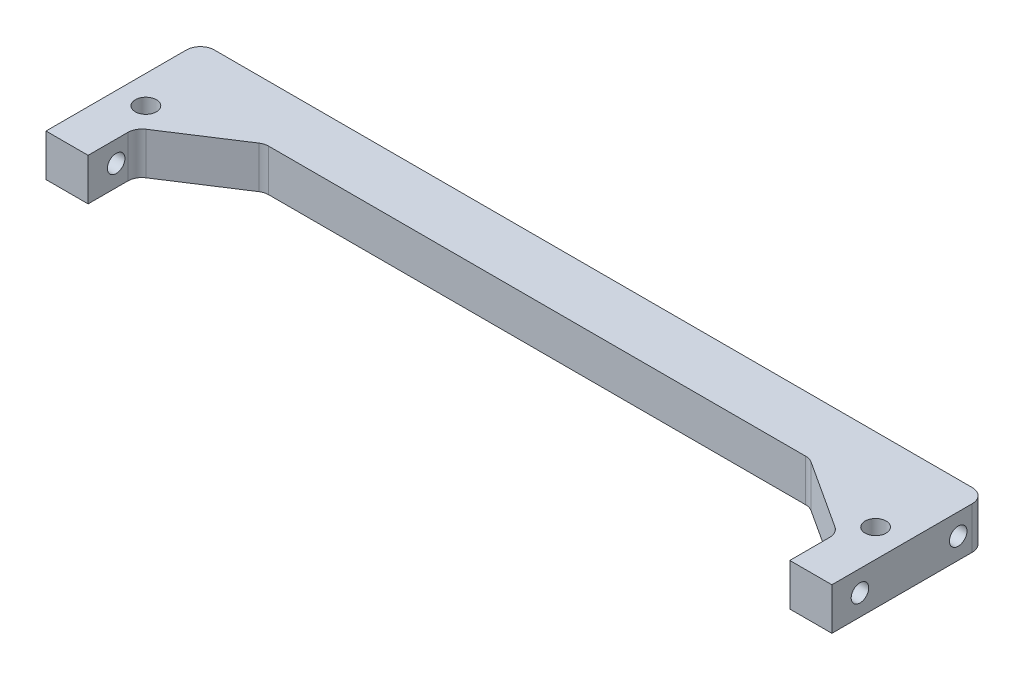
from build123d import *

# Parameters (mm, degrees)
SKETCH1_R                        = 1.5
BOSS_EXTRUDE1_DEPTH              = 6
FILLET1_R                        = 2
TAP_DRILL_FOR_M3_TAP1_AT_2_COUNT = 2
TAP_DRILL_FOR_M3_TAP1_AT_2_PITCH = 14
FILLET1_OF_MIRROR1_R             = 2


with BuildPart() as part:
    # Sketch1 → Boss-Extrude1 (new body)
    with BuildSketch(Plane(origin=(0, 0, 0), x_dir=(1, 0, 0), z_dir=(0, 1, 0))):
        Polygon((0, -22), (-56, -22), (-56, -44), (-50, -44), (-50, -37.239832831), (-38.851635079, -30), (0, -30), align=None)
        with Locations((-51.997575213, -33.767620171)):
            Circle(SKETCH1_R, mode=Mode.SUBTRACT)
    boss_extrude1 = extrude(amount=BOSS_EXTRUDE1_DEPTH)

    # Fillet1
    fillet1_edges = [part.edges().sort_by_distance(p)[0] for p in [
        (-56, 3, 22),
        (-50, 3, 37.239832831),
        (-38.851635079, 3, 30),
    ]]
    fillet(fillet1_edges, radius=FILLET1_R)

    # Sketch2 → Tap Drill for M3 Tap1 (revolve, cut)
    with BuildSketch(Plane(origin=(-56, 3, 26), x_dir=(0, 0, 1), z_dir=(0, 1, 0))):
        Polygon((0, 0), (0, 10.751075774), (1.25, 10), (1.25, 0), align=None)
    tap_drill_for_m3_tap1 = revolve(axis=Axis((-62.35, 3, 26), (1, 0, 0)), mode=Mode.SUBTRACT)

    # Tap Drill for M3 Tap1 at 2: Tap Drill for M3 Tap1 ×2
    with Locations(*[(0, 0, i * TAP_DRILL_FOR_M3_TAP1_AT_2_PITCH) for i in range(1, TAP_DRILL_FOR_M3_TAP1_AT_2_COUNT)]):
        add(tap_drill_for_m3_tap1, mode=Mode.SUBTRACT)

    # Mirror1: Boss-Extrude1, Tap Drill for M3 Tap1 across plane
    add(boss_extrude1.mirror(Plane(origin=(0, 6, 30), x_dir=(0, 0, 1), z_dir=(-1, 0, 0))))
    add(tap_drill_for_m3_tap1.mirror(Plane(origin=(0, 6, 30), x_dir=(0, 0, 1), z_dir=(-1, 0, 0))), mode=Mode.SUBTRACT)

    # Mirror1 copy 1 sketch → Mirror1 copy 1 (revolve, cut)
    with BuildSketch(Plane(origin=(56, 3, 40), x_dir=(0, 0, 1), z_dir=(0, 1, 0))):
        Polygon((0, 0), (0, -10.751075774), (1.25, -10), (1.25, 0), align=None)
    revolve(axis=Axis((62.35, 3, 40), (1, 0, 0)), mode=Mode.SUBTRACT)

    # Fillet1 of Mirror1
    fillet1_of_mirror1_edges = [part.edges().sort_by_distance(p)[0] for p in [
        (56, 3, 22),
        (50, 3, 37.239832831),
        (38.851635079, 3, 30),
    ]]
    fillet(fillet1_of_mirror1_edges, radius=FILLET1_OF_MIRROR1_R)


solid = part.part
